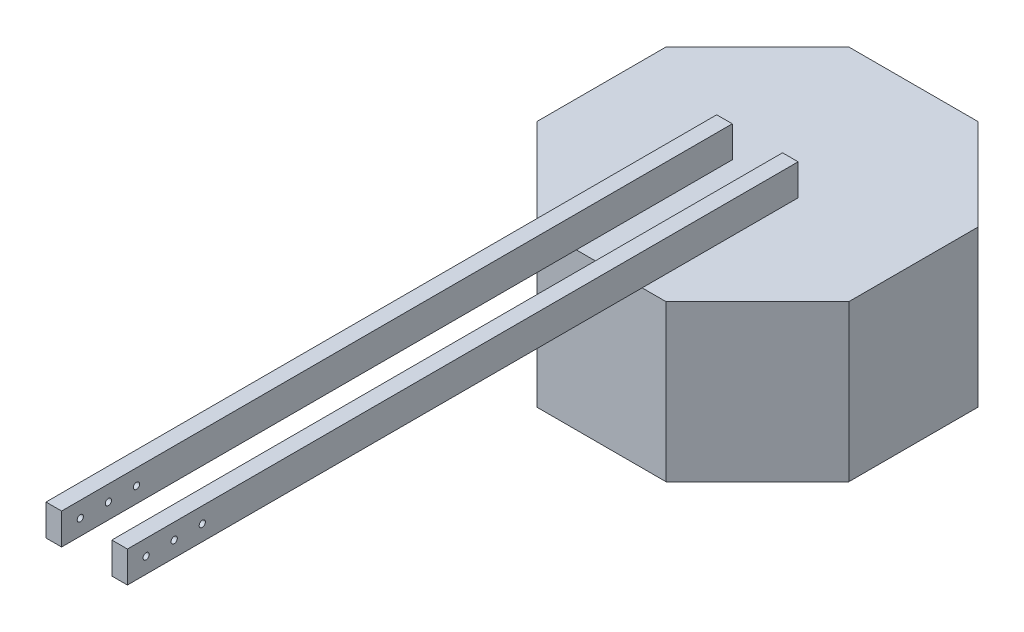
from build123d import *

# Parameters (mm, degrees)
BOSS_EXTRUDE1_DEPTH = 100
SKETCH2_W           = 10
SKETCH2_H           = 430
BOSS_EXTRUDE2_DEPTH = 20
SKETCH3_R           = 2
CUT_EXTRUDE1_DEPTH  = 464.897844358


with BuildPart() as part:
    # Sketch1 → Boss-Extrude1 (new body)
    with BuildSketch(Plane(origin=(0, 0, 0), x_dir=(1, 0, 0), z_dir=(0, 1, 0))):
        Polygon((100, -41.421356237), (100, 41.421356237), (41.421356237, 100), (-41.421356237, 100), (-100, 41.421356237), (-100, -41.421356237), (-41.421356237, -100), (41.421356237, -100), align=None)
    extrude(amount=BOSS_EXTRUDE1_DEPTH)

    # Sketch2 → Boss-Extrude2 (add)
    with BuildSketch(Plane(origin=(0, 100, 0), x_dir=(1, 0, 0), z_dir=(0, 1, 0))):
        with Locations((-21.1, -215)):
            Rectangle(SKETCH2_W, SKETCH2_H)
        with Locations((21.1, -215)):
            Rectangle(SKETCH2_W, SKETCH2_H)
    extrude(amount=BOSS_EXTRUDE2_DEPTH)

    # Sketch3 → Cut-Extrude1 (cut, through all)
    with BuildSketch(Plane.ZY.offset(26.1)):
        with Locations((418, 110)):
            Circle(SKETCH3_R)
        with Locations((400, 110)):
            Circle(SKETCH3_R)
        with Locations((382, 110)):
            Circle(SKETCH3_R)
    extrude(amount=-CUT_EXTRUDE1_DEPTH, mode=Mode.SUBTRACT)


solid = part.part
